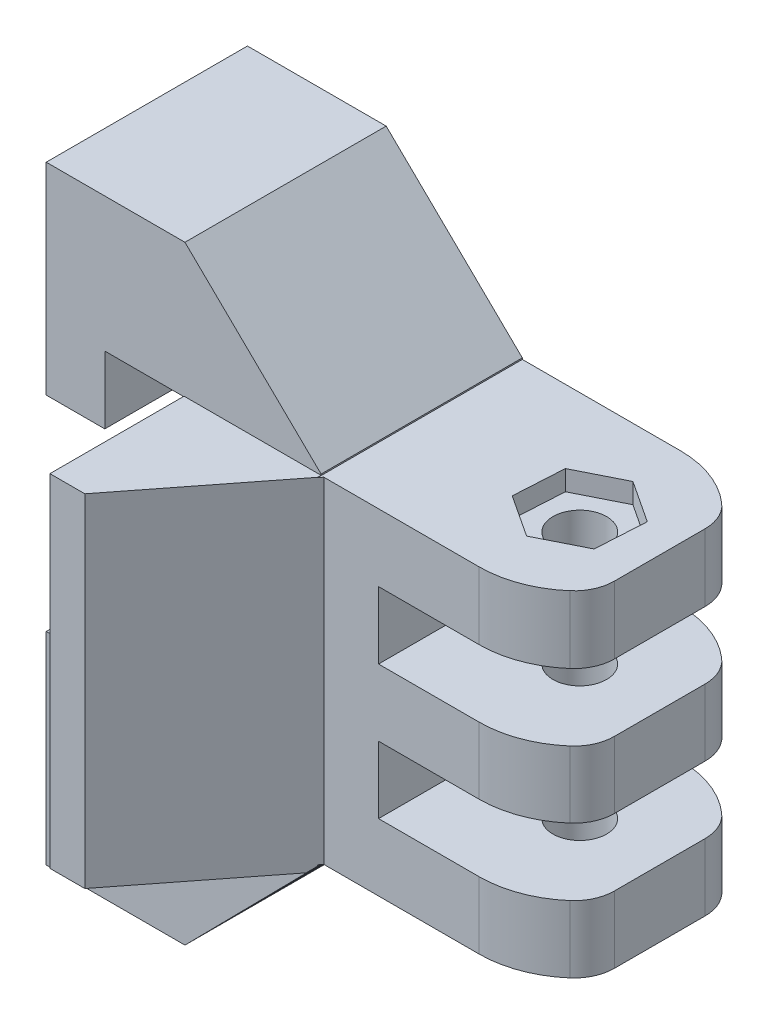
from build123d import *

# Parameters (mm, degrees)
BOSS_EXTRUDE1_DEPTH = 15
FILLET1_R           = 7.5
SKETCH2_R           = 2
CUT_EXTRUDE1_DEPTH  = 56.055379886
SKETCH3_R           = 4.5
CUT_EXTRUDE2_DEPTH  = 0.6
CUT_EXTRUDE3_DEPTH  = 1.5
SKETCH5_W           = 11.340962939
SKETCH5_H           = 24.83561836
CUT_EXTRUDE4_DEPTH  = 56.308893581
FILLET2_R           = 3
SKETCH6_W           = 2.415249458
SKETCH6_H           = 25.484257417
BOSS_EXTRUDE2_DEPTH = 10
CHAMFER1_SIZE       = 8
CHAMFER1_SIZE_2     = 10.239533058


# Some blends are built 0.0001 mm under size
with BuildPart() as part:
    # Sketch1 → Boss-Extrude1 (new body)
    with BuildSketch(Plane.XY):
        Polygon((27.272753899, 35.386642786), (20.490738927, 35.386642786), (20.490738927, 35.487239574), (10.340798609, 45.376041655), (0, 45.376041655), (0, 30.338888881), (4.365624999, 30.338888881), (4.365624999, 35.365972213), (10.274652775, 35.365972213), (10.274652775, 25.091319438), (1.278819444, 25.091319438), (1.278819444, 20.372916662), (10.274652775, 20.372916662), (10.274652775, 9.921874998), (4.365624999, 9.921874998), (4.365624999, 15.081249996), (0, 15.081249996), (0, 0), (10.340798609, 0), (20.490738927, 10.304280596), (20.490738927, 10.386962888), (27.272753899, 10.386962888), (39.772593849, 10.386962888), (39.772593849, 15.38338487), (24.772648106, 15.38338487), (24.772648106, 20.383251948), (39.772593849, 20.383251948), (39.772593849, 22.886802837), (39.772593849, 25.362792962), (24.772648106, 25.362792962), (24.772648106, 30.36266004), (39.772593849, 30.36266004), (39.772593849, 35.386642786), align=None)
    extrude(amount=BOSS_EXTRUDE1_DEPTH)

    # Fillet1
    fillet1_edges = [part.edges().sort_by_distance(p)[0] for p in [
        (39.772593849, 32.874651413, 0),
        (39.772593849, 22.873022455, 0),
        (39.772593849, 12.885173879, 0),
        (39.772593849, 32.874651413, 15),
        (39.772593849, 22.873022455, 15),
        (39.772593849, 12.885173879, 15),
    ]]
    fillet(fillet1_edges, radius=FILLET1_R - 0.0001)  # a hair under: the kernel refuses the full size

    # Sketch2 → Cut-Extrude1 (cut, through all)
    with BuildSketch(Plane.XZ.offset(-10.386962888)):
        with Locations(Location((32.272593849, 7.5, 0), (0, 0, 270))):
            Circle(SKETCH2_R)
    extrude(amount=-CUT_EXTRUDE1_DEPTH, mode=Mode.SUBTRACT)

    # Sketch3 → Cut-Extrude2 (cut)
    with BuildSketch(Plane(origin=(0, 10.386962888, 0), x_dir=(-1, 0, 0), z_dir=(0, -1, 0))):
        with Locations(Location((-32.272593849, -7.5, 0), (0, 0, 90))):
            Circle(SKETCH3_R)
    extrude(amount=-CUT_EXTRUDE2_DEPTH, mode=Mode.SUBTRACT)

    # Sketch4 → Cut-Extrude3 (cut)
    with BuildSketch(Plane(origin=(0, 35.386642786, 0), x_dir=(1, 0, 0), z_dir=(0, 1, 0))):
        Polygon((35.624325063, -5.818215869), (32.491991675, -3.756423556), (29.14026046, -5.438207687), (28.920862634, -9.181784131), (32.053196023, -11.243576444), (35.404927237, -9.561792313), align=None)
    extrude(amount=-CUT_EXTRUDE3_DEPTH, mode=Mode.SUBTRACT)

    # Sketch5 → Cut-Extrude4 (cut, through all)
    with BuildSketch(Plane(origin=(0, 35.386642786, 0), x_dir=(1, 0, 0), z_dir=(0, 1, 0))):
        with Locations((43.904057381, -8.645001066)):
            Rectangle(SKETCH5_W, SKETCH5_H)
    extrude(amount=-CUT_EXTRUDE4_DEPTH, mode=Mode.SUBTRACT)

    # Fillet2
    fillet2_edges = [part.edges().sort_by_distance(p)[0] for p in [
        (38.233575911, 12.885173879, 2.948374426),
        (38.233575911, 12.885173879, 12.051625574),
        (38.233575911, 22.873022455, 12.051625574),
        (38.233575911, 22.873022455, 2.948374426),
        (38.233575911, 32.874651413, 12.051625574),
        (38.233575911, 32.874651413, 2.948374426),
    ]]
    fillet(fillet2_edges, radius=FILLET2_R)

    # Sketch6 → Boss-Extrude2 (add)
    with BuildSketch(Plane.XY.offset(15)):
        with Locations((11.482277504, 22.664003707)):
            Rectangle(SKETCH6_W, SKETCH6_H)
    extrude(amount=BOSS_EXTRUDE2_DEPTH)

    # Chamfer1
    # the kernel refuses this chamfer: 10.239533058, 8 mm, written as the material it adds along each edge
    with BuildSketch(Plane(origin=(12.689902233, 9.921874998, 15), x_dir=(0.9992360216896828, 0, -0.03908161918057676), z_dir=(0, 1, 0))) as chamfer1_piece_1_section:
        Polygon((CHAMFER1_SIZE * 0.99923602169, -CHAMFER1_SIZE * 0.0390816191806), (-CHAMFER1_SIZE_2 * 0.0390816191788, -CHAMFER1_SIZE_2 * 0.999236021645), (0, 0), align=None)
    chamfer1_piece_1 = extrude(amount=25.484257417, mode=Mode.PRIVATE)
    chamfer1_piece_1 = split(chamfer1_piece_1, bisect_by=Plane(origin=(20.793346788, 10.386962888, 14.678631533), z_dir=(0, 1, 0)), keep=Keep.TOP, mode=Mode.PRIVATE)
    chamfer1_piece_1 = split(chamfer1_piece_1, bisect_by=Plane(origin=(20.737221422, 10.554511111, 14.678631533), z_dir=(0.7124220763083485, -0.7017512274221556, 0)), keep=Keep.TOP, mode=Mode.PRIVATE)
    add(chamfer1_piece_1)
    with BuildSketch(Plane(origin=(12.689902233, 9.921874998, 15), x_dir=(0.9992360216896828, 0, -0.03908161918057676), z_dir=(0, 1, 0))) as chamfer1_piece_2_section:
        Polygon((CHAMFER1_SIZE * 0.99923602169, -CHAMFER1_SIZE * 0.0390816191806), (-CHAMFER1_SIZE_2 * 0.0390816191788, -CHAMFER1_SIZE_2 * 0.999236021645), (0, 0), align=None)
    chamfer1_piece_2 = extrude(amount=25.484257417, mode=Mode.PRIVATE)
    chamfer1_piece_2 = split(chamfer1_piece_2, bisect_by=Plane(origin=(15.274873459, 10.386962888, 18.392715242), z_dir=(0, -1, 0)), keep=Keep.TOP, mode=Mode.PRIVATE)
    chamfer1_piece_2 = split(chamfer1_piece_2, bisect_by=Plane(origin=(20.490738927, 10.154752313, 18.392715242), z_dir=(-1, 0, 0)), keep=Keep.TOP, mode=Mode.PRIVATE)
    chamfer1_piece_2 = split(chamfer1_piece_2, bisect_by=Plane(origin=(17.84740539, 7.620752455, 18.392715242), z_dir=(-0.7124220763083485, 0.7017512274221556, 0)), keep=Keep.TOP, mode=Mode.PRIVATE)
    chamfer1_piece_2 = split(chamfer1_piece_2, bisect_by=Plane(origin=(15.274873459, 10.154752313, 25), z_dir=(0, 0, -1)), keep=Keep.TOP, mode=Mode.PRIVATE)
    add(chamfer1_piece_2)
    with BuildSketch(Plane(origin=(12.689902233, 9.921874998, 15), x_dir=(0.9992360216896828, 0, -0.03908161918057676), z_dir=(0, 1, 0))) as chamfer1_piece_3_section:
        Polygon((CHAMFER1_SIZE * 0.99923602169, -CHAMFER1_SIZE * 0.0390816191806), (-CHAMFER1_SIZE_2 * 0.0390816191788, -CHAMFER1_SIZE_2 * 0.999236021645), (0, 0), align=None)
    chamfer1_piece_3 = extrude(amount=25.484257417, mode=Mode.PRIVATE)
    chamfer1_piece_3 = split(chamfer1_piece_3, bisect_by=Plane(origin=(20.673018583, 35.386642786, 14.762443719), z_dir=(0, -1, 0)), keep=Keep.TOP, mode=Mode.PRIVATE)
    chamfer1_piece_3 = split(chamfer1_piece_3, bisect_by=Plane(origin=(20.673018583, 10.386962888, 14.762443719), z_dir=(0, 1, 0)), keep=Keep.TOP, mode=Mode.PRIVATE)
    chamfer1_piece_3 = split(chamfer1_piece_3, bisect_by=Plane(origin=(20.490738927, 22.896544527, 14.762443719), z_dir=(1, 0, 0)), keep=Keep.TOP, mode=Mode.PRIVATE)
    chamfer1_piece_3 = split(chamfer1_piece_3, bisect_by=Plane(origin=(26.875918459, 16.786553348, 14.762443719), z_dir=(-0.7124220763083485, 0.7017512274221556, 0)), keep=Keep.TOP, mode=Mode.PRIVATE)
    chamfer1_piece_3 = split(chamfer1_piece_3, bisect_by=Plane(origin=(26.87746344, 29.264833071, 14.762443719), z_dir=(-0.6978327483962767, -0.7162607453055758, 0)), keep=Keep.TOP, mode=Mode.PRIVATE)
    add(chamfer1_piece_3)
    with BuildSketch(Plane(origin=(12.689902233, 9.921874998, 15), x_dir=(0.9992360216896828, 0, -0.03908161918057676), z_dir=(0, 1, 0))) as chamfer1_piece_4_section:
        Polygon((CHAMFER1_SIZE * 0.99923602169, -CHAMFER1_SIZE * 0.0390816191806), (-CHAMFER1_SIZE_2 * 0.0390816191788, -CHAMFER1_SIZE_2 * 0.999236021645), (0, 0), align=None)
    chamfer1_piece_4 = extrude(amount=25.484257417, mode=Mode.PRIVATE)
    chamfer1_piece_4 = split(chamfer1_piece_4, bisect_by=Plane(origin=(15.290163511, 35.386642786, 18.382453995), z_dir=(0, -1, 0)), keep=Keep.TOP, mode=Mode.PRIVATE)
    chamfer1_piece_4 = split(chamfer1_piece_4, bisect_by=Plane(origin=(15.290163511, 10.386962888, 18.382453995), z_dir=(0, 1, 0)), keep=Keep.TOP, mode=Mode.PRIVATE)
    chamfer1_piece_4 = split(chamfer1_piece_4, bisect_by=Plane(origin=(20.490738927, 22.886802837, 18.382453995), z_dir=(-1, 0, 0)), keep=Keep.TOP, mode=Mode.PRIVATE)
    chamfer1_piece_4 = split(chamfer1_piece_4, bisect_by=Plane(origin=(15.290163511, 22.886802837, 25), z_dir=(0, 0, -1)), keep=Keep.TOP, mode=Mode.PRIVATE)
    add(chamfer1_piece_4)
    with BuildSketch(Plane(origin=(12.689902233, 9.921874998, 15), x_dir=(0.9992360216896828, 0, -0.03908161918057676), z_dir=(0, 1, 0))) as chamfer1_piece_5_section:
        Polygon((CHAMFER1_SIZE * 0.99923602169, -CHAMFER1_SIZE * 0.0390816191806), (-CHAMFER1_SIZE_2 * 0.0390816191788, -CHAMFER1_SIZE_2 * 0.999236021645), (0, 0), align=None)
    chamfer1_piece_5 = extrude(amount=25.484257417, mode=Mode.PRIVATE)
    chamfer1_piece_5 = split(chamfer1_piece_5, bisect_by=Plane(origin=(20.802968311, 35.386642786, 14.671925701), z_dir=(0, -1, 0)), keep=Keep.TOP, mode=Mode.PRIVATE)
    chamfer1_piece_5 = split(chamfer1_piece_5, bisect_by=Plane(origin=(20.752085711, 35.232616736, 14.671925701), z_dir=(0.6978327483962767, 0.7162607453055758, 0)), keep=Keep.TOP, mode=Mode.PRIVATE)
    add(chamfer1_piece_5)
    with BuildSketch(Plane(origin=(12.689902233, 9.921874998, 15), x_dir=(0.9992360216896828, 0, -0.03908161918057676), z_dir=(0, 1, 0))) as chamfer1_piece_6_section:
        Polygon((CHAMFER1_SIZE * 0.99923602169, -CHAMFER1_SIZE * 0.0390816191806), (-CHAMFER1_SIZE_2 * 0.0390816191788, -CHAMFER1_SIZE_2 * 0.999236021645), (0, 0), align=None)
    chamfer1_piece_6 = extrude(amount=25.484257417, mode=Mode.PRIVATE)
    chamfer1_piece_6 = split(chamfer1_piece_6, bisect_by=Plane(origin=(15.290163511, 35.386642786, 18.382453995), z_dir=(0, 1, 0)), keep=Keep.TOP, mode=Mode.PRIVATE)
    chamfer1_piece_6 = split(chamfer1_piece_6, bisect_by=Plane(origin=(20.490738927, 35.396387601, 18.382453995), z_dir=(-1, 0, 0)), keep=Keep.TOP, mode=Mode.PRIVATE)
    chamfer1_piece_6 = split(chamfer1_piece_6, bisect_by=Plane(origin=(15.290163511, 35.396387601, 25), z_dir=(0, 0, -1)), keep=Keep.TOP, mode=Mode.PRIVATE)
    add(chamfer1_piece_6)


solid = part.part
